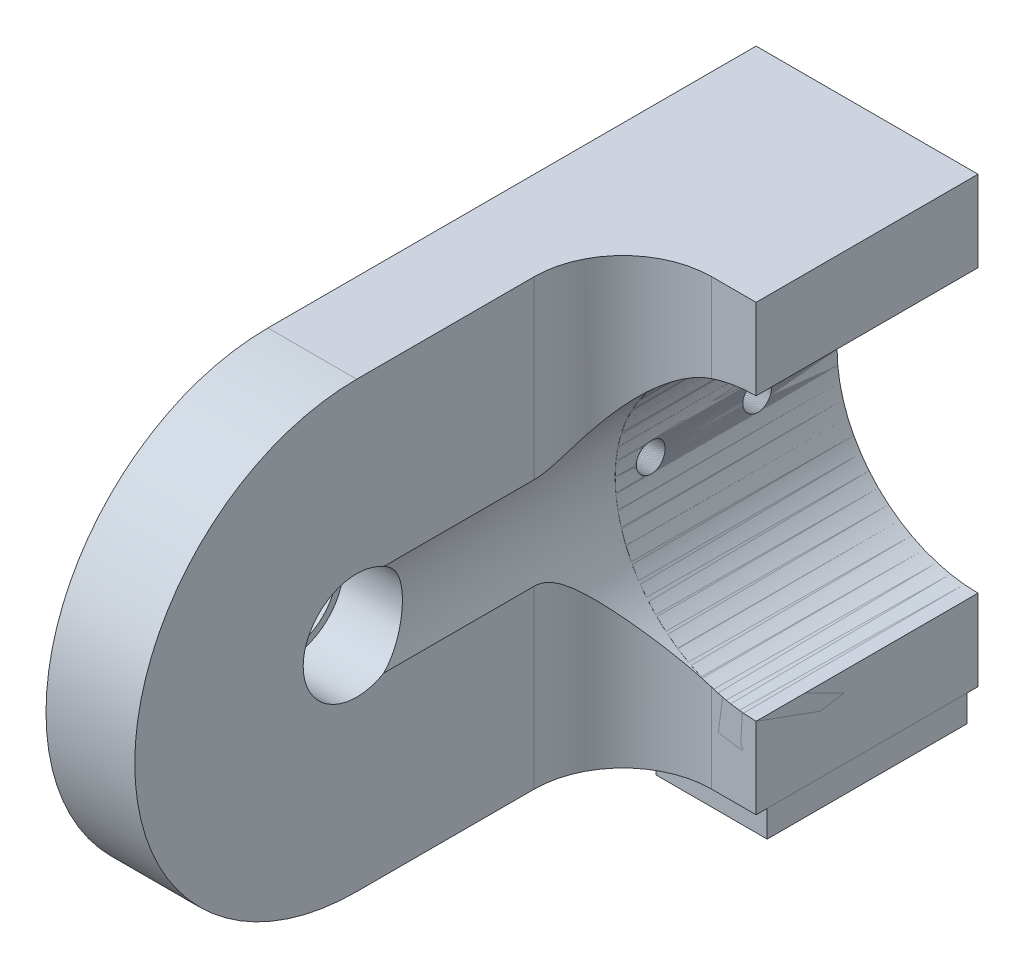
from build123d import *

# Parameters (mm, degrees)
CENTRE_HOLE_FOR_L2_DEPTH      = 40
CENTRE_HOLE_FOR_L2_DEPTH_BACK = 10
SKETCH1_R                     = 39.1
SKETCH1_R_2                   = 31.75
MAIN_STRUCTURE_DEPTH          = 60
MAIN_STRUCTURE_DEPTH_BACK     = 50
SKETCH2_W                     = 100
SKETCH2_H                     = 100
SKETCH2_R                     = 31.75
BEARING_CURVE_DEPTH           = 20
SHAFT_HOLE_REACH              = 189.083
SKETCH6_R                     = 10.5
WRIST_CUTOUT_DEPTH            = 188.082869365
SKETCH9_R                     = 12.05
BEARING_DEPTH                 = 15
SURFACECUT1_DEPTH             = 50
SKETCH13_W                    = 25
SKETCH13_H                    = 45
SKETCH13_R                    = 2.525
BOSS_EXTRUDE1_DEPTH           = 6
SKETCH14_R                    = 3.25
CUT_EXTRUDE2_DEPTH            = 168.7378908


# Read off the part's stored shape, not the designer's step: SurfaceCut1
with BuildPart() as part:
    # Sketch1 → Centre Hole for L2 (new, two sides: drawn at the far end of the back side and taken through both)
    with BuildSketch(Plane.XY.offset(-CENTRE_HOLE_FOR_L2_DEPTH_BACK)):
        Circle(SKETCH1_R)
        Circle(SKETCH1_R_2, mode=Mode.SUBTRACT)
    extrude(amount=CENTRE_HOLE_FOR_L2_DEPTH + CENTRE_HOLE_FOR_L2_DEPTH_BACK)


with BuildPart() as body_2:
    # Sketch2 → Main Structure (new, two sides: drawn at the far end of the back side and taken through both)
    with BuildSketch(Plane.XY.offset(40).offset(-MAIN_STRUCTURE_DEPTH_BACK)):
        Rectangle(SKETCH2_W, SKETCH2_H)
        Circle(SKETCH2_R, mode=Mode.SUBTRACT)
    extrude(amount=MAIN_STRUCTURE_DEPTH + MAIN_STRUCTURE_DEPTH_BACK)

    # Sketch3 → Bearing Curve (add)
    with BuildSketch(Plane.ZY.offset(50)):
        with BuildLine():
            Line((100, 50), (100, -50))
            ThreePointArc((100, -50), (150, 0), (100, 50))
        make_face()
    bearing_curve = extrude(amount=-BEARING_CURVE_DEPTH)

    # Upright Mirror: Bearing Curve across plane
    add(bearing_curve.mirror(Plane(origin=(0, 0, 0), x_dir=(0, 0, 1), z_dir=(1, 0, 0))))

    # Shaft Hole: up to this face of the body (flat: up to its plane)
    shaft_hole_end = Plane(body_2.part.faces().sort_by_distance((-30, 0, 121.220659079))[0])
    # Sketch6 → Shaft Hole (cut, up to the picked face)
    with BuildSketch(Plane.ZY.offset(50), mode=Mode.PRIVATE) as shaft_hole_sk1:
        with Locations((100, 0)):
            Circle(SKETCH6_R)
    shaft_hole_tool1 = split(extrude(shaft_hole_sk1.sketch, amount=-SHAFT_HOLE_REACH, mode=Mode.PRIVATE), bisect_by=shaft_hole_end, keep=Keep.BOTH, mode=Mode.PRIVATE)
    add(shaft_hole_tool1.solids().sort_by(Axis((-50, 0, 100), (1, 0, 0)))[0], mode=Mode.SUBTRACT)

    # Sketch4 → Wrist Cutout (cut, through all)
    with BuildSketch(Plane(origin=(0, 50, 0), x_dir=(1, 0, 0), z_dir=(0, 1, 0))):
        with BuildLine():
            Line((-30, -100), (-30, -60))
            ThreePointArc((-30, -60), (-24.142135624, -45.857864376), (-10, -40))
            Line((-10, -40), (10, -40))
            ThreePointArc((10, -40), (24.142135624, -45.857864376), (30, -60))
            Line((30, -60), (30, -100))
            Line((30, -100), (-30, -100))
        make_face()
    extrude(amount=-WRIST_CUTOUT_DEPTH, mode=Mode.SUBTRACT)

    # Sketch9 → Bearing (cut)
    with BuildSketch(Plane(origin=(-30, 0, 0), x_dir=(0, 0, -1), z_dir=(1, 0, 0))):
        with Locations(Location((-100, 0, 0), (0, 0, 59.619002111))):
            Circle(SKETCH9_R)
    extrude(amount=-BEARING_DEPTH, mode=Mode.SUBTRACT)


with BuildPart() as surfacecut1_tool:
    # SurfaceCut1 outline → SurfaceCut1 (new body)
    with BuildSketch(Plane.YZ):
        with BuildLine():
            ThreePointArc((50, 100), (0, 150), (-50, 100))
            Line((-50, 100), (-50, -10))
            Line((-50, -10), (50, -10))
            Line((50, -10), (50, 100))
        make_face()
    extrude(amount=SURFACECUT1_DEPTH)


with BuildPart() as part_1:
    add(part.part)

    # SurfaceCut1: cut by surfacecut1_tool
    add(surfacecut1_tool.part, mode=Mode.SUBTRACT)


with BuildPart() as body_2_1:
    add(body_2.part)

    # SurfaceCut1: cut by surfacecut1_tool
    add(surfacecut1_tool.part, mode=Mode.SUBTRACT)


with BuildPart() as body_3:
    # Sketch13 → Boss-Extrude1 (new body)
    with BuildSketch(Plane(origin=(0, -50, 0), x_dir=(-1, 0, 0), z_dir=(0, -1, 0))):
        with Locations((12.5, -15)):
            Rectangle(SKETCH13_W, SKETCH13_H)
        with Locations(Location((19, -31, 0), (0, 0, 90))):
            Circle(SKETCH13_R, mode=Mode.SUBTRACT)
        with Locations(Location((19, 1, 0), (0, 0, 90))):
            Circle(SKETCH13_R, mode=Mode.SUBTRACT)
    extrude(amount=BOSS_EXTRUDE1_DEPTH)


with BuildPart() as cut_extrude2_tool:
    # Sketch14 → Cut-Extrude2 (new, through all)
    with BuildSketch(Plane.ZY.offset(50)):
        with Locations((8, 0)):
            Circle(SKETCH14_R)
        with Locations((32, 0)):
            Circle(SKETCH14_R)
    extrude(amount=-CUT_EXTRUDE2_DEPTH)


with BuildPart() as part_2:
    add(part_1.part)

    # Cut-Extrude2: cut by cut_extrude2_tool
    add(cut_extrude2_tool.part, mode=Mode.SUBTRACT)


with BuildPart() as body_2_2:
    add(body_2_1.part)

    # Cut-Extrude2: cut by cut_extrude2_tool
    add(cut_extrude2_tool.part, mode=Mode.SUBTRACT)


solid = Compound([body_3.part, part_2.part, body_2_2.part])
